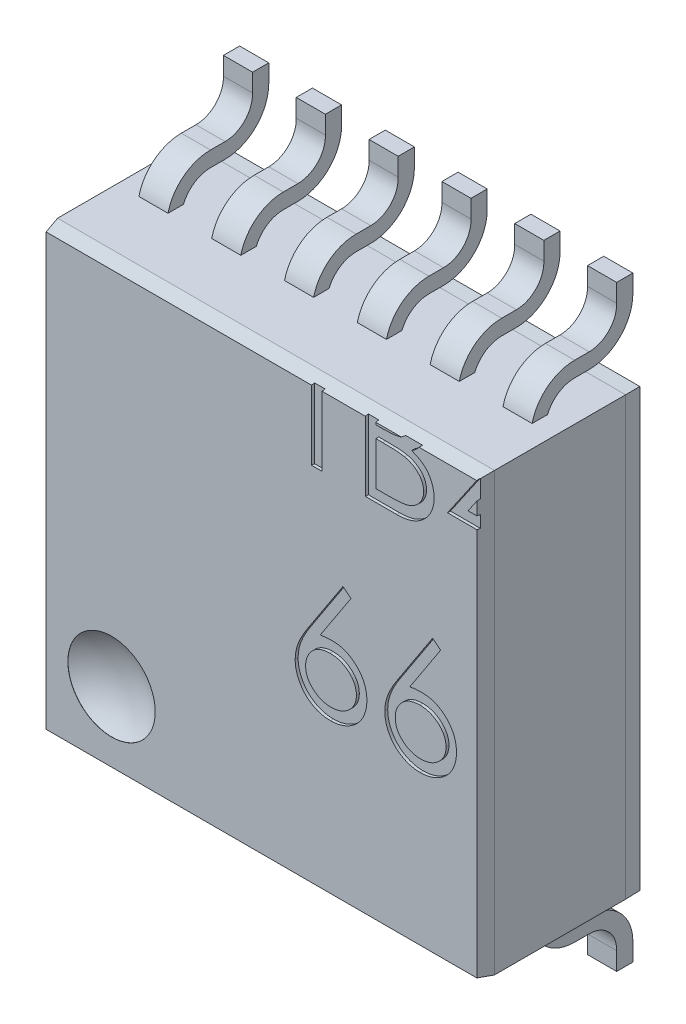
from build123d import *
from OCP.BRepFilletAPI import BRepFilletAPI_MakeChamfer

# Parameters (mm, degrees)
SKETCH1_W          = 3
SKETCH1_H          = 3
EXTRUDE2_DEPTH     = 1.1
CHAMFER2_SIZE      = 0.1
CHAMFER2_SIZE2     = 0.021255656
CHAMFER3_SIZE      = 0.1
CHAMFER3_SIZE2     = 0.001745506
SKETCH2_W          = 0.2
SKETCH2_H          = 0.548769717
EXTRUDE3_DEPTH     = 0.7
EXTRUDE3_2_DEPTH   = 0.7
EXTRUDE3_3_DEPTH   = 0.7
EXTRUDE3_4_DEPTH   = 0.7
EXTRUDE3_5_DEPTH   = 0.7
EXTRUDE3_6_DEPTH   = 0.7
EXTRUDE4_DEPTH     = 5.17080471
MIRROR1_START      = -3.15
MIRROR1_DEPTH      = 0.2
MIRROR1_START_2    = -2.65
MIRROR1_2_DEPTH    = 0.2
MIRROR1_START_3    = -2.15
MIRROR1_3_DEPTH    = 0.2
MIRROR1_START_4    = -1.65
MIRROR1_4_DEPTH    = 0.2
MIRROR1_START_5    = -1.15
MIRROR1_5_DEPTH    = 0.2
MIRROR1_START_6    = -0.65
MIRROR1_6_DEPTH    = 0.2
SKETCH4_R          = 0.3
EXTRUDE5_DEPTH     = 0.001
DOME1_FACE_RADIUS  = 0.3
DOME1_HEIGHT       = 0.1
CUT_EXTRUDE1_DEPTH = 0.02


with BuildPart() as part:
    # Sketch1 → Extrude2 (new body)
    with BuildSketch(Plane.XY.offset(0.1)):
        with Locations((-1.8, -0.75)):
            Rectangle(SKETCH1_W, SKETCH1_H)
    extrude(amount=EXTRUDE2_DEPTH)

    # Chamfer2: one chamfer whose edges measure the first distance from different faces: ONE call of the kernel's chamfer builder (chamfer() names one face for all edges)
    chamfer2_edges_1 = [part.edges().sort_by_distance(p)[0] for p in [
        (-0.3, -0.75, 1.2),
    ]]
    chamfer2_side_1 = [part.faces().sort_by_distance(p)[0] for p in [
        (-0.3, -0.75, 0.65),
    ]]
    chamfer2_edges_2 = [part.edges().sort_by_distance(p)[0] for p in [
        (-1.8, 0.75, 1.2),
    ]]
    chamfer2_side_2 = [part.faces().sort_by_distance(p)[0] for p in [
        (-1.8, 0.75, 0.65),
    ]]
    chamfer2_edges_3 = [part.edges().sort_by_distance(p)[0] for p in [
        (-3.3, -0.75, 1.2),
    ]]
    chamfer2_side_3 = [part.faces().sort_by_distance(p)[0] for p in [
        (-3.3, -0.75, 0.65),
    ]]
    chamfer2_edges_4 = [part.edges().sort_by_distance(p)[0] for p in [
        (-1.8, -2.25, 1.2),
    ]]
    chamfer2_side_4 = [part.faces().sort_by_distance(p)[0] for p in [
        (-1.8, -2.25, 0.65),
    ]]
    chamfer2 = BRepFilletAPI_MakeChamfer(part.part.solid().wrapped)
    for e in chamfer2_edges_1:
        chamfer2.Add(CHAMFER2_SIZE, CHAMFER2_SIZE2, e.wrapped, chamfer2_side_1[0].wrapped)  # the first distance lies on this face
    for e in chamfer2_edges_2:
        chamfer2.Add(CHAMFER2_SIZE, CHAMFER2_SIZE2, e.wrapped, chamfer2_side_2[0].wrapped)  # the first distance lies on this face
    for e in chamfer2_edges_3:
        chamfer2.Add(CHAMFER2_SIZE, CHAMFER2_SIZE2, e.wrapped, chamfer2_side_3[0].wrapped)  # the first distance lies on this face
    for e in chamfer2_edges_4:
        chamfer2.Add(CHAMFER2_SIZE, CHAMFER2_SIZE2, e.wrapped, chamfer2_side_4[0].wrapped)  # the first distance lies on this face
    add(Compound.cast(chamfer2.Shape()), mode=Mode.REPLACE)

    # Chamfer3: one chamfer whose edges measure the first distance from different faces: ONE call of the kernel's chamfer builder (chamfer() names one face for all edges)
    chamfer3_edges_1 = [part.edges().sort_by_distance(p)[0] for p in [
        (-1.8, 0.75, 0.1),
    ]]
    chamfer3_side_1 = [part.faces().sort_by_distance(p)[0] for p in [
        (-1.8, 0.75, 0.6),
    ]]
    chamfer3_edges_2 = [part.edges().sort_by_distance(p)[0] for p in [
        (-0.3, -0.75, 0.1),
    ]]
    chamfer3_side_2 = [part.faces().sort_by_distance(p)[0] for p in [
        (-0.3, -0.75, 0.6),
    ]]
    chamfer3_edges_3 = [part.edges().sort_by_distance(p)[0] for p in [
        (-1.8, -2.25, 0.1),
    ]]
    chamfer3_side_3 = [part.faces().sort_by_distance(p)[0] for p in [
        (-1.8, -2.25, 0.6),
    ]]
    chamfer3_edges_4 = [part.edges().sort_by_distance(p)[0] for p in [
        (-3.3, -0.75, 0.1),
    ]]
    chamfer3_side_4 = [part.faces().sort_by_distance(p)[0] for p in [
        (-3.3, -0.75, 0.6),
    ]]
    chamfer3 = BRepFilletAPI_MakeChamfer(part.part.solid().wrapped)
    for e in chamfer3_edges_1:
        chamfer3.Add(CHAMFER3_SIZE, CHAMFER3_SIZE2, e.wrapped, chamfer3_side_1[0].wrapped)  # the first distance lies on this face
    for e in chamfer3_edges_2:
        chamfer3.Add(CHAMFER3_SIZE, CHAMFER3_SIZE2, e.wrapped, chamfer3_side_2[0].wrapped)  # the first distance lies on this face
    for e in chamfer3_edges_3:
        chamfer3.Add(CHAMFER3_SIZE, CHAMFER3_SIZE2, e.wrapped, chamfer3_side_3[0].wrapped)  # the first distance lies on this face
    for e in chamfer3_edges_4:
        chamfer3.Add(CHAMFER3_SIZE, CHAMFER3_SIZE2, e.wrapped, chamfer3_side_4[0].wrapped)  # the first distance lies on this face
    add(Compound.cast(chamfer3.Shape()), mode=Mode.REPLACE)

    # Mirror1: read off the stored shape, not the designer's step
    # Mirror1 outline → Mirror1 (add)
    with BuildSketch(Plane.YZ.offset(MIRROR1_START)):
        with BuildLine():
            Line((1.298769717, 0), (1.298769717, 0.111270078))
            Line((1.298769717, 0.111270078), (1.175, 0.111270078))
            ThreePointArc((1.175, 0.111270078), (1.037816324, 0.164485937), (0.980481976, 0.3))
            Line((0.980481976, 0.3), (0.980481976, 0.400050091))
            ThreePointArc((0.980481976, 0.400050091), (0.915912865, 0.585986361), (0.75, 0.691884367))
            Line((0.75, 0.691884367), (0.75, 0.585404962))
            ThreePointArc((0.75, 0.585404962), (0.84083124, 0.511803399), (0.875, 0.4))
            Line((0.875, 0.4), (0.875, 0.3))
            ThreePointArc((0.875, 0.3), (0.962867966, 0.087867966), (1.175, 0))
            Line((1.175, 0), (1.298769717, 0))
        make_face()
    extrude(amount=MIRROR1_DEPTH)

    # Mirror1 2 outline → Mirror1 2 (add)
    with BuildSketch(Plane.YZ.offset(MIRROR1_START_2)):
        with BuildLine():
            Line((1.298769717, 0), (1.298769717, 0.111270078))
            Line((1.298769717, 0.111270078), (1.175, 0.111270078))
            ThreePointArc((1.175, 0.111270078), (1.037816324, 0.164485937), (0.980481976, 0.3))
            Line((0.980481976, 0.3), (0.980481976, 0.400050091))
            ThreePointArc((0.980481976, 0.400050091), (0.915912865, 0.585986361), (0.75, 0.691884367))
            Line((0.75, 0.691884367), (0.75, 0.585404962))
            ThreePointArc((0.75, 0.585404962), (0.84083124, 0.511803399), (0.875, 0.4))
            Line((0.875, 0.4), (0.875, 0.3))
            ThreePointArc((0.875, 0.3), (0.962867966, 0.087867966), (1.175, 0))
            Line((1.175, 0), (1.298769717, 0))
        make_face()
    extrude(amount=MIRROR1_2_DEPTH)

    # Mirror1 3 outline → Mirror1 3 (add)
    with BuildSketch(Plane.YZ.offset(MIRROR1_START_3)):
        with BuildLine():
            Line((1.298769717, 0), (1.298769717, 0.111270078))
            Line((1.298769717, 0.111270078), (1.175, 0.111270078))
            ThreePointArc((1.175, 0.111270078), (1.037816324, 0.164485937), (0.980481976, 0.3))
            Line((0.980481976, 0.3), (0.980481976, 0.400050091))
            ThreePointArc((0.980481976, 0.400050091), (0.915912865, 0.585986361), (0.75, 0.691884367))
            Line((0.75, 0.691884367), (0.75, 0.585404962))
            ThreePointArc((0.75, 0.585404962), (0.84083124, 0.511803399), (0.875, 0.4))
            Line((0.875, 0.4), (0.875, 0.3))
            ThreePointArc((0.875, 0.3), (0.962867966, 0.087867966), (1.175, 0))
            Line((1.175, 0), (1.298769717, 0))
        make_face()
    extrude(amount=MIRROR1_3_DEPTH)

    # Mirror1 4 outline → Mirror1 4 (add)
    with BuildSketch(Plane.YZ.offset(MIRROR1_START_4)):
        with BuildLine():
            Line((1.298769717, 0), (1.298769717, 0.111270078))
            Line((1.298769717, 0.111270078), (1.175, 0.111270078))
            ThreePointArc((1.175, 0.111270078), (1.037816324, 0.164485937), (0.980481976, 0.3))
            Line((0.980481976, 0.3), (0.980481976, 0.400050091))
            ThreePointArc((0.980481976, 0.400050091), (0.915912865, 0.585986361), (0.75, 0.691884367))
            Line((0.75, 0.691884367), (0.75, 0.585404962))
            ThreePointArc((0.75, 0.585404962), (0.84083124, 0.511803399), (0.875, 0.4))
            Line((0.875, 0.4), (0.875, 0.3))
            ThreePointArc((0.875, 0.3), (0.962867966, 0.087867966), (1.175, 0))
            Line((1.175, 0), (1.298769717, 0))
        make_face()
    extrude(amount=MIRROR1_4_DEPTH)

    # Mirror1 5 outline → Mirror1 5 (add)
    with BuildSketch(Plane.YZ.offset(MIRROR1_START_5)):
        with BuildLine():
            Line((1.298769717, 0), (1.298769717, 0.111270078))
            Line((1.298769717, 0.111270078), (1.175, 0.111270078))
            ThreePointArc((1.175, 0.111270078), (1.037816324, 0.164485937), (0.980481976, 0.3))
            Line((0.980481976, 0.3), (0.980481976, 0.400050091))
            ThreePointArc((0.980481976, 0.400050091), (0.915912865, 0.585986361), (0.75, 0.691884367))
            Line((0.75, 0.691884367), (0.75, 0.585404962))
            ThreePointArc((0.75, 0.585404962), (0.84083124, 0.511803399), (0.875, 0.4))
            Line((0.875, 0.4), (0.875, 0.3))
            ThreePointArc((0.875, 0.3), (0.962867966, 0.087867966), (1.175, 0))
            Line((1.175, 0), (1.298769717, 0))
        make_face()
    extrude(amount=MIRROR1_5_DEPTH)

    # Mirror1 6 outline → Mirror1 6 (add)
    with BuildSketch(Plane.YZ.offset(MIRROR1_START_6)):
        with BuildLine():
            Line((1.298769717, 0), (1.298769717, 0.111270078))
            Line((1.298769717, 0.111270078), (1.175, 0.111270078))
            ThreePointArc((1.175, 0.111270078), (1.037816324, 0.164485937), (0.980481976, 0.3))
            Line((0.980481976, 0.3), (0.980481976, 0.400050091))
            ThreePointArc((0.980481976, 0.400050091), (0.915912865, 0.585986361), (0.75, 0.691884367))
            Line((0.75, 0.691884367), (0.75, 0.585404962))
            ThreePointArc((0.75, 0.585404962), (0.84083124, 0.511803399), (0.875, 0.4))
            Line((0.875, 0.4), (0.875, 0.3))
            ThreePointArc((0.875, 0.3), (0.962867966, 0.087867966), (1.175, 0))
            Line((1.175, 0), (1.298769717, 0))
        make_face()
    extrude(amount=MIRROR1_6_DEPTH)

    # Sketch4 → Extrude5 (cut)
    with BuildSketch(Plane.XY.offset(1.2)):
        with Locations((-2.829613335, -1.750129606)):
            Circle(SKETCH4_R)
    extrude(amount=-EXTRUDE5_DEPTH, mode=Mode.SUBTRACT)

    # Dome1: a dome of height H over a round flat face of radius A is a cap of a sphere of radius (A * A + H * H) / (2 * H)
    dome1_r = (DOME1_FACE_RADIUS * DOME1_FACE_RADIUS + DOME1_HEIGHT * DOME1_HEIGHT) / (2 * DOME1_HEIGHT)
    dome1_base = Plane((-2.829613335, -1.750129606, 1.199), z_dir=(0, 0, -1))
    with Locations(dome1_base.offset(DOME1_HEIGHT - dome1_r)):
        dome1_ball = Sphere(dome1_r, mode=Mode.PRIVATE)
    add(split(dome1_ball, bisect_by=dome1_base, keep=Keep.TOP, mode=Mode.PRIVATE), mode=Mode.SUBTRACT)

    # Sketch5 → Cut-Extrude1 (cut)
    # profile 1 of 14: a face of its own
    with BuildSketch(Plane.XY.offset(1.2)):
        Polygon((-1.630273204, 0.970399683), (-1.630273204, 1.052450965), (-1.209760384, 1.052450965), (-1.209760384, 0.970399683), (-1.384119358, 0.970399683), (-1.384119358, 0.252450965), (-1.45591423, 0.252450965), (-1.45591423, 0.970399683), align=None)
    # profile 2 of 14: a face of its own
    with BuildSketch(Plane.XY.offset(1.2)):
        with BuildLine():
            Line((-1.086683461, 1.052450965), (-0.930593717, 1.052450965))
            add(Edge.make_bspline(
                [(-0.930593717, 1.052450965), (-0.922952922, 1.052410794), (-0.90814316, 1.052332931), (-0.886607287, 1.051125358), (-0.866436131, 1.049478805), (-0.84762384, 1.046866213), (-0.830179108, 1.043713807), (-0.814049362, 1.039896249), (-0.799285894, 1.035318737), (-0.781660126, 1.028039587), (-0.761563975, 1.017222863), (-0.739804342, 1.001239191), (-0.721197659, 0.981688913), (-0.705155072, 0.959635735), (-0.692400531, 0.93537613), (-0.683173263, 0.909488315), (-0.677331463, 0.882306203), (-0.676730678, 0.863644905), (-0.676427051, 0.854213786)],
                knots=[0, 0, 0, 0, 1.001505555, 1.941167018, 2.826882275, 3.653841531, 4.429895133, 5.150066043, 5.825578002, 6.45369114, 7.647487171, 8.808567382, 9.977351308, 11.170798116, 12.373658725, 13.556498008, 14.765093433, 16, 16, 16, 16], degree=3))
            add(Edge.make_bspline(
                [(-0.676427051, 0.854213786), (-0.676676929, 0.845378916), (-0.677167964, 0.828017563), (-0.681863452, 0.802624624), (-0.689214462, 0.778452917), (-0.699432804, 0.755590657), (-0.712713261, 0.734554403), (-0.728452305, 0.715174457), (-0.747441288, 0.698271358), (-0.761668315, 0.688821551), (-0.768894999, 0.684021478)],
                knots=[0, 0, 0, 0, 1.044552857, 2.05264487, 3.044412934, 4.028983338, 5.005914585, 5.980388656, 6.974128949, 8, 8, 8, 8], degree=3))
            add(Edge.make_bspline(
                [(-0.768894999, 0.684021478), (-0.759806902, 0.680532335), (-0.742419119, 0.673856741), (-0.718490888, 0.66205435), (-0.697874923, 0.649217296), (-0.680412719, 0.635198587), (-0.665478397, 0.620088002), (-0.652437725, 0.603663976), (-0.641310554, 0.58571226), (-0.631776171, 0.566420023), (-0.624336456, 0.545984259), (-0.61876482, 0.524596653), (-0.615572261, 0.502333897), (-0.615117943, 0.487182953), (-0.614888589, 0.479534299)],
                knots=[0, 0, 0, 0, 1.27268992, 2.434971085, 3.483601985, 4.442670788, 5.356604649, 6.2567628, 7.179492994, 8.113709626, 9.066344395, 10.018646069, 10.999752585, 12, 12, 12, 12], degree=3))
            add(Edge.make_bspline(
                [(-0.614888589, 0.479534299), (-0.615111868, 0.471724728), (-0.615551176, 0.456359179), (-0.618792312, 0.433786576), (-0.624280108, 0.41221516), (-0.631839227, 0.391505404), (-0.641704899, 0.371697373), (-0.653711291, 0.352768627), (-0.668027077, 0.334909352), (-0.684041447, 0.317921095), (-0.702158509, 0.302646172), (-0.721704967, 0.289042582), (-0.742926983, 0.277854911), (-0.765476011, 0.268456963), (-0.789604997, 0.261278175), (-0.815205593, 0.256255872), (-0.842255719, 0.252871864), (-0.860817948, 0.252593645), (-0.870337307, 0.252450965)],
                knots=[0, 0, 0, 0, 0.978564426, 1.925352924, 2.850884081, 3.763762016, 4.682927383, 5.618979971, 6.567305752, 7.547517671, 8.540179244, 9.531824382, 10.526200242, 11.540722885, 12.589160233, 13.674978461, 14.80764778, 16, 16, 16, 16], degree=3))
            Line((-0.870337307, 0.252450965), (-1.086683461, 0.252450965))
            Line((-1.086683461, 0.252450965), (-1.086683461, 1.052450965))
        make_face()
        with BuildLine():
            Line((-1.014888589, 0.970399683), (-1.014888589, 0.713989427))
            Line((-1.014888589, 0.713989427), (-0.96665141, 0.713989427))
            add(Edge.make_bspline(
                [(-0.96665141, 0.713989427), (-0.959600256, 0.714080838), (-0.945975991, 0.714257462), (-0.926245729, 0.714763409), (-0.907931439, 0.716180105), (-0.891064735, 0.717596393), (-0.875672176, 0.719899156), (-0.861787865, 0.722640213), (-0.8491939, 0.725539163), (-0.834670575, 0.730469331), (-0.818196758, 0.737755657), (-0.800634906, 0.749063505), (-0.785152742, 0.762531929), (-0.772079099, 0.77807272), (-0.761379334, 0.795184991), (-0.753947628, 0.813595706), (-0.748908248, 0.832846022), (-0.748453041, 0.846061623), (-0.748221922, 0.852771478)],
                knots=[0, 0, 0, 0, 1.156816544, 2.235205308, 3.236616184, 4.169592532, 5.011045266, 5.787822928, 6.49130361, 7.128639758, 8.301311294, 9.436451833, 10.541879658, 11.654887649, 12.756523258, 13.837046038, 14.901820046, 16, 16, 16, 16], degree=3))
            add(Edge.make_bspline(
                [(-0.748221922, 0.852771478), (-0.748342192, 0.857211654), (-0.748578114, 0.865921545), (-0.750510298, 0.87861854), (-0.753794315, 0.89055997), (-0.758012439, 0.90190948), (-0.763906996, 0.912312189), (-0.770847217, 0.922127777), (-0.779232517, 0.931021975), (-0.788777046, 0.939335003), (-0.799750445, 0.946705181), (-0.812146169, 0.953160213), (-0.826131924, 0.958358105), (-0.841472005, 0.962910368), (-0.858402539, 0.966107692), (-0.876728152, 0.968771324), (-0.896598945, 0.970127379), (-0.910346397, 0.970306891), (-0.917452692, 0.970399683)],
                knots=[0, 0, 0, 0, 0.91205012, 1.789085906, 2.630437955, 3.453916878, 4.269457761, 5.079663411, 5.91843418, 6.774407191, 7.675494373, 8.627863946, 9.638891023, 10.736472738, 11.911756761, 13.175263542, 14.539845004, 16, 16, 16, 16], degree=3))
            Line((-0.917452692, 0.970399683), (-1.014888589, 0.970399683))
        make_face(mode=Mode.SUBTRACT)
        with BuildLine():
            Line((-1.014888589, 0.631938145), (-1.014888589, 0.334502247))
            Line((-1.014888589, 0.334502247), (-0.912644999, 0.334502247))
            add(Edge.make_bspline(
                [(-0.912644999, 0.334502247), (-0.905326388, 0.334589961), (-0.891220729, 0.334759018), (-0.870854733, 0.335310916), (-0.851978595, 0.336566293), (-0.83467845, 0.338542487), (-0.818767489, 0.340686133), (-0.804436586, 0.343568711), (-0.79156957, 0.346871331), (-0.776649728, 0.351976284), (-0.759848926, 0.359906906), (-0.741743588, 0.371864444), (-0.725646166, 0.386109771), (-0.711976393, 0.402596837), (-0.700773424, 0.420523998), (-0.692623606, 0.439528649), (-0.687597124, 0.45929677), (-0.686988628, 0.472774876), (-0.686683461, 0.479534299)],
                knots=[0, 0, 0, 0, 1.160039823, 2.235823828, 3.228722157, 4.157150951, 4.99529583, 5.772374946, 6.472645482, 7.099169577, 8.269452708, 9.405989375, 10.527446681, 11.663510218, 12.788923519, 13.866172445, 14.929861265, 16, 16, 16, 16], degree=3))
            add(Edge.make_bspline(
                [(-0.686683461, 0.479534299), (-0.68674657, 0.483761348), (-0.686871772, 0.492147264), (-0.688759912, 0.504470879), (-0.69150594, 0.516408222), (-0.695055982, 0.527991705), (-0.700226145, 0.539011906), (-0.706261927, 0.549686777), (-0.713338819, 0.560030429), (-0.724366057, 0.573107515), (-0.740405368, 0.588174261), (-0.763195488, 0.60292569), (-0.789109156, 0.614822332), (-0.807904011, 0.619873641), (-0.817612948, 0.622483017)],
                knots=[0, 0, 0, 0, 0.723448775, 1.435228256, 2.130040452, 2.821711965, 3.505591119, 4.210454504, 4.921174351, 5.648778258, 7.137944449, 8.670945889, 10.280296675, 12, 12, 12, 12], degree=3))
            add(Edge.make_bspline(
                [(-0.817612948, 0.622483017), (-0.821505313, 0.62327275), (-0.829944762, 0.624985055), (-0.843706495, 0.62679253), (-0.859417551, 0.62840283), (-0.877114209, 0.629593951), (-0.896818858, 0.630825161), (-0.918573582, 0.631303977), (-0.94228954, 0.631875237), (-0.958744939, 0.631916639), (-0.967292435, 0.631938145)],
                knots=[0, 0, 0, 0, 0.634451884, 1.375622551, 2.216452059, 3.157844607, 4.20941857, 5.370758133, 6.634282058, 8, 8, 8, 8], degree=3))
            Line((-0.967292435, 0.631938145), (-1.014888589, 0.631938145))
        make_face(mode=Mode.SUBTRACT)
    # profile 3 of 14: a face of its own
    with BuildSketch(Plane.XY.offset(1.2)):
        Polygon((-0.085882179, 1.072963786), (-0.071298845, 1.072963786), (-0.071298845, 0.519117632), (0.021008847, 0.519117632), (0.021008847, 0.43706635), (-0.071298845, 0.43706635), (-0.071298845, 0.252450965), (-0.143093717, 0.252450965), (-0.143093717, 0.43706635), (-0.522580897, 0.43706635), align=None)
        Polygon((-0.143093717, 0.519117632), (-0.143093717, 0.866553529), (-0.381555256, 0.519117632), align=None, mode=Mode.SUBTRACT)
    # profile 4 of 14: a face of its own
    with BuildSketch(Plane.XY.offset(1.2)):
        Polygon((0.529502437, 1.072963786), (0.54408577, 1.072963786), (0.54408577, 0.519117632), (0.636393462, 0.519117632), (0.636393462, 0.43706635), (0.54408577, 0.43706635), (0.54408577, 0.252450965), (0.472290898, 0.252450965), (0.472290898, 0.43706635), (0.092803719, 0.43706635), align=None)
        Polygon((0.472290898, 0.519117632), (0.472290898, 0.866553529), (0.23382936, 0.519117632), align=None, mode=Mode.SUBTRACT)
    # profile 5 of 14: a face of its own
    with BuildSketch(Plane.XY.offset(1.2)):
        with BuildLine():
            Line((1.210752437, 1.052450965), (1.210752437, 0.970399683))
            Line((1.210752437, 0.970399683), (0.938637052, 0.970399683))
            Line((0.938637052, 0.970399683), (0.895528078, 0.759983017))
            add(Edge.make_bspline(
                [(0.895528078, 0.759983017), (0.903997992, 0.762321364), (0.920407111, 0.766851543), (0.944626508, 0.771881434), (0.967619011, 0.774913535), (0.982539096, 0.775327549), (0.989758847, 0.775527888)],
                knots=[0, 0, 0, 0, 1.100273476, 2.13160584, 3.095893838, 4, 4, 4, 4], degree=3))
            add(Edge.make_bspline(
                [(0.989758847, 0.775527888), (0.998692273, 0.775334532), (1.016257621, 0.774954344), (1.041957952, 0.771303635), (1.066491184, 0.765557369), (1.089806012, 0.757529821), (1.111945566, 0.74726474), (1.132706152, 0.734441896), (1.152399389, 0.719462849), (1.170671982, 0.702241132), (1.187248967, 0.68328762), (1.20182405, 0.662908678), (1.214204071, 0.641302355), (1.224160815, 0.618262216), (1.23211152, 0.594042981), (1.237403404, 0.568389819), (1.240927223, 0.541544534), (1.241320912, 0.523189204), (1.241521667, 0.51382917)],
                knots=[0, 0, 0, 0, 1.052922333, 2.070308379, 3.05430497, 4.020497103, 4.973039431, 5.925935799, 6.892292201, 7.88610001, 8.88166317, 9.857072816, 10.836096531, 11.812156883, 12.81219415, 13.836441305, 14.89672472, 16, 16, 16, 16], degree=3))
            add(Edge.make_bspline(
                [(1.241521667, 0.51382917), (1.24136965, 0.507309806), (1.24106767, 0.49435918), (1.239531993, 0.47512622), (1.236575258, 0.456300429), (1.232605492, 0.437879311), (1.22745294, 0.41989774), (1.221215442, 0.402304248), (1.213582064, 0.385208338), (1.205209178, 0.368448248), (1.195781412, 0.352402875), (1.185317753, 0.337397392), (1.174262783, 0.323206699), (1.16236761, 0.309982989), (1.149521668, 0.297813156), (1.135880533, 0.286624978), (1.121553054, 0.276229245), (1.10631757, 0.267047943), (1.090513574, 0.258599268), (1.073912839, 0.251668173), (1.05689325, 0.245471481), (1.03920985, 0.240532161), (1.020902693, 0.236661862), (1.001941601, 0.234033154), (0.982426019, 0.232118539), (0.969197445, 0.231998686), (0.962515257, 0.231938145)],
                knots=[0, 0, 0, 0, 1.056347294, 2.098418968, 3.122841568, 4.141288669, 5.149314143, 6.15115421, 7.162517403, 8.180376062, 9.185164535, 10.17417709, 11.141909838, 12.097768115, 13.052685741, 14.0056014, 14.954263652, 15.917497458, 16.885230207, 17.854509472, 18.828990115, 19.81800267, 20.826176721, 21.857883937, 22.917946725, 24, 24, 24, 24], degree=3))
            add(Edge.make_bspline(
                [(0.962515257, 0.231938145), (0.954544016, 0.232096051), (0.93886154, 0.232406712), (0.915885411, 0.235656651), (0.893779215, 0.240311261), (0.872720906, 0.247313837), (0.85252176, 0.256088075), (0.83345371, 0.267177486), (0.815029533, 0.279744138), (0.79799821, 0.294573933), (0.782191099, 0.310783232), (0.76804104, 0.32837355), (0.755439079, 0.347054565), (0.744587023, 0.366917), (0.735330332, 0.387908665), (0.728058335, 0.410108208), (0.722188996, 0.433399637), (0.719705929, 0.449434725), (0.718444744, 0.45757917)],
                knots=[0, 0, 0, 0, 1.0467383, 2.05933395, 3.04377827, 4.011590433, 4.970194871, 5.932262533, 6.905835911, 7.896367577, 8.894135286, 9.877477877, 10.858688626, 11.851381753, 12.8477658, 13.868841284, 14.917554742, 16, 16, 16, 16], degree=3))
            Line((0.718444744, 0.45757917), (0.790239616, 0.45757917))
            add(Edge.make_bspline(
                [(0.790239616, 0.45757917), (0.792006143, 0.449950267), (0.795401507, 0.435287091), (0.80285425, 0.414685642), (0.81196645, 0.396326962), (0.82280173, 0.3799682), (0.835727451, 0.365703286), (0.850477035, 0.352990815), (0.867013657, 0.341522214), (0.885389252, 0.331962724), (0.904775099, 0.323809866), (0.925064747, 0.318380908), (0.945705741, 0.314563561), (0.959666511, 0.314181444), (0.966681924, 0.313989427)],
                knots=[0, 0, 0, 0, 1.136247022, 2.183929868, 3.172523383, 4.106158343, 5.02341133, 5.958108904, 6.928429099, 7.938127109, 8.96079061, 9.975095812, 10.982467395, 12, 12, 12, 12], degree=3))
            add(Edge.make_bspline(
                [(0.966681924, 0.313989427), (0.973529568, 0.314177033), (0.987012636, 0.314546432), (1.006855239, 0.317389634), (1.026012467, 0.321768508), (1.044295292, 0.328321618), (1.062023644, 0.336286125), (1.078749077, 0.346506713), (1.094955449, 0.358269003), (1.110139022, 0.371744804), (1.124045182, 0.38659502), (1.136332295, 0.402475567), (1.146567018, 0.419416561), (1.155191958, 0.43712471), (1.161741283, 0.455794095), (1.166413507, 0.47533722), (1.169157064, 0.495802359), (1.169534476, 0.509761058), (1.169726796, 0.516874042)],
                knots=[0, 0, 0, 0, 1.027316725, 2.022795036, 3.002884548, 3.971462791, 4.93288096, 5.914575861, 6.907176829, 7.935150275, 8.956128384, 9.956726525, 10.942570165, 11.921478529, 12.907843606, 13.90538589, 14.932640048, 16, 16, 16, 16], degree=3))
            add(Edge.make_bspline(
                [(1.169726796, 0.516874042), (1.169576286, 0.523291357), (1.169281685, 0.535852337), (1.166874697, 0.554229299), (1.162687961, 0.571617423), (1.156876788, 0.588100676), (1.149498615, 0.603694606), (1.140482315, 0.618415305), (1.129658681, 0.632068753), (1.117294821, 0.644661337), (1.103750126, 0.656283022), (1.088791556, 0.666190242), (1.072732144, 0.674524852), (1.055765379, 0.681717537), (1.037487688, 0.686883422), (1.018261029, 0.690761796), (0.997877781, 0.693005307), (0.983941624, 0.693316596), (0.976778078, 0.693476606)],
                knots=[0, 0, 0, 0, 1.045622112, 2.046656509, 3.013763289, 3.955457236, 4.890082067, 5.820317437, 6.762574623, 7.722996705, 8.69280354, 9.665887285, 10.63943826, 11.638615906, 12.663482002, 13.728887084, 14.832589034, 16, 16, 16, 16], degree=3))
            add(Edge.make_bspline(
                [(0.976778078, 0.693476606), (0.97057718, 0.6933439), (0.957773898, 0.693069894), (0.938134395, 0.691052409), (0.917496287, 0.687797713), (0.895938688, 0.683320857), (0.873396858, 0.677462325), (0.849918366, 0.670441868), (0.825453848, 0.662048268), (0.808969797, 0.655709476), (0.800496026, 0.652450965)],
                knots=[0, 0, 0, 0, 0.817624296, 1.688186739, 2.600797293, 3.572016777, 4.590301741, 5.671205678, 6.80286297, 8, 8, 8, 8], degree=3))
            Line((0.800496026, 0.652450965), (0.882547308, 1.052450965))
            Line((0.882547308, 1.052450965), (1.210752437, 1.052450965))
        make_face()
    # profile 6 of 14: a face of its own
    with BuildSketch(Plane.XY.offset(1.2)):
        Polygon((1.723572949, 1.052450965), (2.092803719, 0.252450965), (2.014758847, 0.252450965), (1.896489616, 0.508861222), (1.53382936, 0.508861222), (1.412194744, 0.252450965), (1.33382936, 0.252450965), (1.713316539, 1.052450965), align=None)
        Polygon((1.717643462, 0.896521478), (1.572771667, 0.590912504), (1.858669103, 0.590912504), align=None, mode=Mode.SUBTRACT)
    # profile 7 of 14: a face of its own
    with BuildSketch(Plane.XY.offset(1.2)):
        Polygon((2.334630642, 1.052450965), (2.482547308, 1.052450965), (2.482547308, 0.252450965), (2.410752437, 0.252450965), (2.410752437, 0.970399683), (2.287675514, 0.970399683), align=None)
    # profile 8 of 14: a face of its own
    with BuildSketch(Plane.XY.offset(1.2)):
        with BuildLine():
            Line((-1.240529615, -0.360369548), (-1.185241153, -0.403799035))
            Line((-1.185241153, -0.403799035), (-1.396619358, -0.727036214))
            add(Edge.make_bspline(
                [(-1.396619358, -0.727036214), (-1.382546152, -0.724793046), (-1.355094772, -0.720417493), (-1.327308281, -0.719695677), (-1.313766794, -0.719343907)],
                knots=[0, 0, 0, 0, 1.025318673, 2, 2, 2, 2], degree=3))
            add(Edge.make_bspline(
                [(-1.313766794, -0.719343907), (-1.305635938, -0.719562446), (-1.289630589, -0.719992636), (-1.266131892, -0.72330323), (-1.243551563, -0.728520398), (-1.221983195, -0.736125485), (-1.20134937, -0.745840309), (-1.18153168, -0.75748348), (-1.162902649, -0.771656207), (-1.145222379, -0.787488196), (-1.129170471, -0.805023507), (-1.114958802, -0.823629527), (-1.103021249, -0.843286871), (-1.093335781, -0.863985583), (-1.085814666, -0.885693757), (-1.080331776, -0.908383618), (-1.077090726, -0.932070811), (-1.076650614, -0.948180108), (-1.076427051, -0.956363137)],
                knots=[0, 0, 0, 0, 1.04369286, 2.054478336, 3.041073146, 4.015093852, 4.984733326, 5.965804835, 6.960378782, 7.985147595, 9.009457201, 10.008161701, 10.986880575, 11.956520048, 12.937015923, 13.931873656, 14.949455224, 16, 16, 16, 16], degree=3))
            add(Edge.make_bspline(
                [(-1.076427051, -0.956363137), (-1.076752332, -0.967558498), (-1.077392408, -0.989588319), (-1.083770418, -1.021674423), (-1.093681194, -1.052241855), (-1.107847487, -1.08080258), (-1.12544346, -1.107317453), (-1.146901195, -1.130811274), (-1.171459707, -1.151764425), (-1.199228118, -1.169285938), (-1.229112224, -1.183595207), (-1.260506966, -1.193872977), (-1.293107457, -1.200200627), (-1.315234224, -1.200993908), (-1.326427051, -1.201395189)],
                knots=[0, 0, 0, 0, 1.031375318, 2.029502543, 3.004789286, 3.987476834, 4.960371455, 5.9300674, 6.912260825, 7.929083631, 8.949397511, 9.960523116, 10.96833055, 12, 12, 12, 12], degree=3))
            add(Edge.make_bspline(
                [(-1.326427051, -1.201395189), (-1.337192011, -1.201045884), (-1.358515512, -1.200353974), (-1.389883008, -1.194190331), (-1.420023126, -1.184200136), (-1.448724699, -1.170436873), (-1.475312268, -1.153052214), (-1.499098699, -1.132123693), (-1.51996539, -1.108098672), (-1.537331018, -1.080980878), (-1.551104442, -1.051840317), (-1.561433568, -1.021454681), (-1.567466995, -0.989934685), (-1.568310094, -0.968567568), (-1.568734743, -0.957805445)],
                knots=[0, 0, 0, 0, 1.012016664, 2.004627821, 2.994792927, 3.992885782, 4.990978636, 5.973936114, 6.964471063, 7.975201453, 8.993600317, 9.990122807, 10.98767138, 12, 12, 12, 12], degree=3))
            add(Edge.make_bspline(
                [(-1.568734743, -0.957805445), (-1.568464698, -0.949566683), (-1.567913319, -0.932744706), (-1.564063401, -0.907267213), (-1.557877162, -0.881198395), (-1.550949106, -0.859083151), (-1.543628967, -0.840966231), (-1.537536958, -0.826359719), (-1.52995433, -0.811328617), (-1.521868986, -0.7953575), (-1.51255313, -0.778857972), (-1.502423839, -0.761554276), (-1.491201061, -0.743721607), (-1.483333595, -0.731620077), (-1.479311666, -0.72543365)],
                knots=[0, 0, 0, 0, 1.173818275, 2.396712641, 3.66331629, 4.989737886, 5.693666774, 6.447286557, 7.243889047, 8.091586357, 8.998013824, 9.943181721, 10.948533338, 12, 12, 12, 12], degree=3))
            Line((-1.479311666, -0.72543365), (-1.240529615, -0.360369548))
        make_face()
        with BuildLine():
            add(Edge.make_bspline(
                [(-1.328830897, -0.801395189), (-1.334925124, -0.801573027), (-1.346828921, -0.801920398), (-1.364293473, -0.803937598), (-1.380822216, -0.807736242), (-1.396634132, -0.81257426), (-1.411433607, -0.819226388), (-1.425328199, -0.827306799), (-1.438371639, -0.836820212), (-1.450427308, -0.847631848), (-1.461357517, -0.859469113), (-1.470770347, -0.872147861), (-1.478889753, -0.885362536), (-1.485491311, -0.899223551), (-1.4906319, -0.913725608), (-1.494350357, -0.928802008), (-1.496419786, -0.94455385), (-1.496764068, -0.955235565), (-1.496939871, -0.96069006)],
                knots=[0, 0, 0, 0, 1.129588631, 2.206414736, 3.251139165, 4.268635594, 5.265702196, 6.250456724, 7.242448911, 8.251968645, 9.246821453, 10.222880186, 11.173611482, 12.116736599, 13.062300278, 14.020270554, 14.989073742, 16, 16, 16, 16], degree=3))
            add(Edge.make_bspline(
                [(-1.496939871, -0.96069006), (-1.496796703, -0.96609577), (-1.496515971, -0.976695562), (-1.493966869, -0.992315946), (-1.490073136, -1.007347925), (-1.484281046, -1.021714005), (-1.477372043, -1.035633163), (-1.468250826, -1.048601228), (-1.458144132, -1.061405816), (-1.446063233, -1.073063295), (-1.433097893, -1.083910523), (-1.419246189, -1.093391724), (-1.404809627, -1.10150285), (-1.389593302, -1.107859672), (-1.3738131, -1.113076652), (-1.357337545, -1.116747847), (-1.340155178, -1.118823396), (-1.328515878, -1.119168126), (-1.322580897, -1.119343907)],
                knots=[0, 0, 0, 0, 0.989467248, 1.94019797, 2.891935182, 3.827694429, 4.772920941, 5.730924762, 6.725747692, 7.756678648, 8.79901574, 9.819492441, 10.826891316, 11.826466727, 12.835195252, 13.867842842, 14.912794438, 16, 16, 16, 16], degree=3))
            add(Edge.make_bspline(
                [(-1.322580897, -1.119343907), (-1.316645926, -1.119168112), (-1.305006645, -1.118823355), (-1.287824139, -1.116748002), (-1.271349095, -1.113076083), (-1.255567036, -1.107861735), (-1.240357566, -1.101495196), (-1.22593363, -1.093442186), (-1.212212923, -1.083852216), (-1.199239071, -1.073081832), (-1.187208457, -1.061339466), (-1.176859365, -1.048715529), (-1.168017483, -1.035528353), (-1.160832526, -1.021768836), (-1.15510423, -1.007339238), (-1.151190752, -0.992318273), (-1.148646915, -0.976694953), (-1.14836546, -0.966095564), (-1.148221922, -0.96069006)],
                knots=[0, 0, 0, 0, 1.087397944, 2.132534446, 3.165364764, 4.174271784, 5.174024072, 6.181601208, 7.194203697, 8.236725232, 9.267838612, 10.269026844, 11.221737037, 12.171628256, 13.107553087, 14.05945871, 15.010357665, 16, 16, 16, 16], degree=3))
            add(Edge.make_bspline(
                [(-1.148221922, -0.96069006), (-1.148347704, -0.955228449), (-1.148594571, -0.944509081), (-1.151386788, -0.928809054), (-1.155259331, -0.913649007), (-1.161106881, -0.899124219), (-1.168703805, -0.885292007), (-1.177957155, -0.872082498), (-1.188661743, -0.859394419), (-1.201026895, -0.847608634), (-1.21448752, -0.836832159), (-1.228799653, -0.827319118), (-1.243772905, -0.819290551), (-1.259392091, -0.812591785), (-1.275836179, -0.80775762), (-1.292839685, -0.803951164), (-1.310620083, -0.80192556), (-1.322683308, -0.801574231), (-1.328830897, -0.801395189)],
                knots=[0, 0, 0, 0, 0.978206639, 1.919901502, 2.851605144, 3.780102724, 4.718870031, 5.675451981, 6.667674623, 7.690630536, 8.733308323, 9.756129687, 10.767539656, 11.776269907, 12.797430371, 13.836405707, 14.897401972, 16, 16, 16, 16], degree=3))
        make_face(mode=Mode.SUBTRACT)
    # profile 9 of 14: a face of its own
    with BuildSketch(Plane.XY.offset(1.2)):
        with BuildLine():
            Line((-0.625144999, -0.360369548), (-0.569856538, -0.403799035))
            Line((-0.569856538, -0.403799035), (-0.781234743, -0.727036214))
            add(Edge.make_bspline(
                [(-0.781234743, -0.727036214), (-0.767161537, -0.724793046), (-0.739710157, -0.720417493), (-0.711923666, -0.719695677), (-0.698382179, -0.719343907)],
                knots=[0, 0, 0, 0, 1.025318673, 2, 2, 2, 2], degree=3))
            add(Edge.make_bspline(
                [(-0.698382179, -0.719343907), (-0.690251322, -0.719562446), (-0.674245974, -0.719992636), (-0.650747276, -0.72330323), (-0.628166948, -0.728520398), (-0.606598579, -0.736125485), (-0.585964755, -0.745840309), (-0.566147064, -0.75748348), (-0.547518034, -0.771656207), (-0.529837764, -0.787488196), (-0.513785856, -0.805023507), (-0.499574186, -0.823629527), (-0.487636634, -0.843286871), (-0.477951166, -0.863985583), (-0.470430051, -0.885693757), (-0.464947161, -0.908383618), (-0.461706111, -0.932070811), (-0.461265999, -0.948180108), (-0.461042435, -0.956363137)],
                knots=[0, 0, 0, 0, 1.04369286, 2.054478336, 3.041073146, 4.015093852, 4.984733326, 5.965804835, 6.960378782, 7.985147595, 9.009457201, 10.008161701, 10.986880575, 11.956520048, 12.937015923, 13.931873656, 14.949455224, 16, 16, 16, 16], degree=3))
            add(Edge.make_bspline(
                [(-0.461042435, -0.956363137), (-0.461367716, -0.967558498), (-0.462007793, -0.989588319), (-0.468385803, -1.021674423), (-0.478296579, -1.052241855), (-0.492462871, -1.08080258), (-0.510058845, -1.107317453), (-0.53151658, -1.130811274), (-0.556075092, -1.151764425), (-0.583843503, -1.169285938), (-0.613727609, -1.183595207), (-0.645122351, -1.193872977), (-0.677722842, -1.200200627), (-0.699849609, -1.200993908), (-0.711042435, -1.201395189)],
                knots=[0, 0, 0, 0, 1.031375318, 2.029502543, 3.004789286, 3.987476834, 4.960371455, 5.9300674, 6.912260825, 7.929083631, 8.949397511, 9.960523116, 10.96833055, 12, 12, 12, 12], degree=3))
            add(Edge.make_bspline(
                [(-0.711042435, -1.201395189), (-0.721807395, -1.201045884), (-0.743130897, -1.200353974), (-0.774498392, -1.194190331), (-0.804638511, -1.184200136), (-0.833340083, -1.170436873), (-0.859927652, -1.153052214), (-0.883714083, -1.132123693), (-0.904580775, -1.108098672), (-0.921946402, -1.080980878), (-0.935719827, -1.051840317), (-0.946048952, -1.021454681), (-0.95208238, -0.989934685), (-0.952925478, -0.968567568), (-0.953350128, -0.957805445)],
                knots=[0, 0, 0, 0, 1.012016664, 2.004627821, 2.994792927, 3.992885782, 4.990978636, 5.973936114, 6.964471063, 7.975201453, 8.993600317, 9.990122807, 10.98767138, 12, 12, 12, 12], degree=3))
            add(Edge.make_bspline(
                [(-0.953350128, -0.957805445), (-0.953080083, -0.949566683), (-0.952528704, -0.932744706), (-0.948678786, -0.907267213), (-0.942492547, -0.881198395), (-0.935564491, -0.859083151), (-0.928244351, -0.840966231), (-0.922152342, -0.826359719), (-0.914569714, -0.811328617), (-0.90648437, -0.7953575), (-0.897168514, -0.778857972), (-0.887039223, -0.761554276), (-0.875816446, -0.743721607), (-0.86794898, -0.731620077), (-0.863927051, -0.72543365)],
                knots=[0, 0, 0, 0, 1.173818275, 2.396712641, 3.66331629, 4.989737886, 5.693666774, 6.447286557, 7.243889047, 8.091586357, 8.998013824, 9.943181721, 10.948533338, 12, 12, 12, 12], degree=3))
            Line((-0.863927051, -0.72543365), (-0.625144999, -0.360369548))
        make_face()
        with BuildLine():
            add(Edge.make_bspline(
                [(-0.713446281, -0.801395189), (-0.719540509, -0.801573027), (-0.731444305, -0.801920398), (-0.748908857, -0.803937598), (-0.7654376, -0.807736242), (-0.781249517, -0.81257426), (-0.796048992, -0.819226388), (-0.809943583, -0.827306799), (-0.822987024, -0.836820212), (-0.835042693, -0.847631848), (-0.845972902, -0.859469113), (-0.855385732, -0.872147861), (-0.863505137, -0.885362536), (-0.870106696, -0.899223551), (-0.875247285, -0.913725608), (-0.878965742, -0.928802008), (-0.881035171, -0.94455385), (-0.881379452, -0.955235565), (-0.881555256, -0.96069006)],
                knots=[0, 0, 0, 0, 1.129588631, 2.206414736, 3.251139165, 4.268635594, 5.265702196, 6.250456724, 7.242448911, 8.251968645, 9.246821453, 10.222880186, 11.173611482, 12.116736599, 13.062300278, 14.020270554, 14.989073742, 16, 16, 16, 16], degree=3))
            add(Edge.make_bspline(
                [(-0.881555256, -0.96069006), (-0.881412087, -0.96609577), (-0.881131356, -0.976695562), (-0.878582254, -0.992315946), (-0.874688521, -1.007347925), (-0.86889643, -1.021714005), (-0.861987427, -1.035633163), (-0.85286621, -1.048601228), (-0.842759516, -1.061405816), (-0.830678617, -1.073063295), (-0.817713277, -1.083910523), (-0.803861574, -1.093391724), (-0.789425012, -1.10150285), (-0.774208687, -1.107859672), (-0.758428484, -1.113076652), (-0.741952929, -1.116747847), (-0.724770562, -1.118823396), (-0.713131262, -1.119168126), (-0.707196281, -1.119343907)],
                knots=[0, 0, 0, 0, 0.989467248, 1.94019797, 2.891935182, 3.827694429, 4.772920941, 5.730924762, 6.725747692, 7.756678648, 8.79901574, 9.819492441, 10.826891316, 11.826466727, 12.835195252, 13.867842842, 14.912794438, 16, 16, 16, 16], degree=3))
            add(Edge.make_bspline(
                [(-0.707196281, -1.119343907), (-0.70126131, -1.119168112), (-0.689622029, -1.118823355), (-0.672439524, -1.116748002), (-0.65596448, -1.113076083), (-0.640182421, -1.107861735), (-0.624972951, -1.101495196), (-0.610549014, -1.093442186), (-0.596828307, -1.083852216), (-0.583854456, -1.073081832), (-0.571823841, -1.061339466), (-0.561474749, -1.048715529), (-0.552632867, -1.035528353), (-0.54544791, -1.021768836), (-0.539719615, -1.007339238), (-0.535806137, -0.992318273), (-0.533262299, -0.976694953), (-0.532980844, -0.966095564), (-0.532837307, -0.96069006)],
                knots=[0, 0, 0, 0, 1.087397944, 2.132534446, 3.165364764, 4.174271784, 5.174024072, 6.181601208, 7.194203697, 8.236725232, 9.267838612, 10.269026844, 11.221737037, 12.171628256, 13.107553087, 14.05945871, 15.010357665, 16, 16, 16, 16], degree=3))
            add(Edge.make_bspline(
                [(-0.532837307, -0.96069006), (-0.532963088, -0.955228449), (-0.533209956, -0.944509081), (-0.536002173, -0.928809054), (-0.539874715, -0.913649007), (-0.545722265, -0.899124219), (-0.55331919, -0.885292007), (-0.56257254, -0.872082498), (-0.573277127, -0.859394419), (-0.585642279, -0.847608634), (-0.599102904, -0.836832159), (-0.613415038, -0.827319118), (-0.628388289, -0.819290551), (-0.644007476, -0.812591785), (-0.660451563, -0.80775762), (-0.67745507, -0.803951164), (-0.695235468, -0.80192556), (-0.707298693, -0.801574231), (-0.713446281, -0.801395189)],
                knots=[0, 0, 0, 0, 0.978206639, 1.919901502, 2.851605144, 3.780102724, 4.718870031, 5.675451981, 6.667674623, 7.690630536, 8.733308323, 9.756129687, 10.767539656, 11.776269907, 12.797430371, 13.836405707, 14.897401972, 16, 16, 16, 16], degree=3))
        make_face(mode=Mode.SUBTRACT)
    # profile 10 of 14: a face of its own
    with BuildSketch(Plane.XY.offset(1.2)):
        Polygon((-0.208959102, -0.380882368), (-0.061042435, -0.380882368), (-0.061042435, -1.180882368), (-0.132837307, -1.180882368), (-0.132837307, -0.46293365), (-0.25591423, -0.46293365), align=None)
    # profile 11 of 14: a face of its own
    with BuildSketch(Plane.XY.offset(1.2)):
        with BuildLine():
            Line((0.338957565, -0.627036214), (0.267162693, -0.627036214))
            add(Edge.make_bspline(
                [(0.267162693, -0.627036214), (0.267630614, -0.61751144), (0.268549597, -0.598805037), (0.272853206, -0.571531001), (0.279011121, -0.545461333), (0.287717739, -0.520805352), (0.298530603, -0.497345053), (0.311497466, -0.475173621), (0.326856061, -0.454375635), (0.344274743, -0.4351439), (0.363193289, -0.417501026), (0.383606075, -0.402265542), (0.405056367, -0.389392932), (0.427479087, -0.378631505), (0.451127215, -0.370553826), (0.475786154, -0.364560308), (0.501564243, -0.360954286), (0.519127676, -0.360566678), (0.528060129, -0.360369548)],
                knots=[0, 0, 0, 0, 1.10065271, 2.161652631, 3.183658789, 4.190468796, 5.17591951, 6.163126047, 7.15150782, 8.156236427, 9.156009102, 10.134482811, 11.092018607, 12.041330605, 13.001268258, 13.972401359, 14.968799086, 16, 16, 16, 16], degree=3))
            add(Edge.make_bspline(
                [(0.528060129, -0.360369548), (0.53683226, -0.360574909), (0.554069185, -0.360978437), (0.579226216, -0.364443815), (0.603175312, -0.369871379), (0.625869659, -0.377486331), (0.647128188, -0.387722772), (0.667110598, -0.400019352), (0.686054784, -0.414241028), (0.703107763, -0.430984757), (0.718766752, -0.448859587), (0.732275839, -0.467942537), (0.743844562, -0.487652088), (0.75348746, -0.508138534), (0.760586006, -0.529594769), (0.765975311, -0.551708415), (0.769021577, -0.574708372), (0.769489103, -0.590275585), (0.769726796, -0.59819006)],
                knots=[0, 0, 0, 0, 1.111607364, 2.184268762, 3.212621178, 4.221274766, 5.211760367, 6.196651075, 7.1921475, 8.207485113, 9.220403448, 10.201281604, 11.166441695, 12.114753415, 13.065576456, 14.026450734, 14.996634279, 16, 16, 16, 16], degree=3))
            add(Edge.make_bspline(
                [(0.769726796, -0.59819006), (0.769339764, -0.609332423), (0.768572493, -0.631421614), (0.762009207, -0.663882154), (0.751758576, -0.695332079), (0.739416323, -0.720643462), (0.726965478, -0.741039689), (0.715745477, -0.757832536), (0.702610663, -0.775913786), (0.687369863, -0.795222892), (0.67033835, -0.815911099), (0.651361855, -0.837965909), (0.630305059, -0.861159456), (0.615525973, -0.877000737), (0.607867821, -0.885209291)],
                knots=[0, 0, 0, 0, 1.184426356, 2.348067706, 3.509069118, 4.696110526, 5.333549288, 6.050745305, 6.844228056, 7.710549037, 8.667450064, 9.695053472, 10.805634456, 12, 12, 12, 12], degree=3))
            Line((0.607867821, -0.885209291), (0.407707565, -1.098831086))
            Line((0.407707565, -1.098831086), (0.779983206, -1.098831086))
            Line((0.779983206, -1.098831086), (0.779983206, -1.180882368))
            Line((0.779983206, -1.180882368), (0.236393462, -1.180882368))
            Line((0.236393462, -1.180882368), (0.546649872, -0.849792625))
            add(Edge.make_bspline(
                [(0.546649872, -0.849792625), (0.554203675, -0.841907297), (0.568712984, -0.826761198), (0.589234716, -0.804648521), (0.607666485, -0.78413434), (0.624127603, -0.765257415), (0.638260976, -0.747741628), (0.6508032, -0.732154267), (0.660852478, -0.717810393), (0.671758854, -0.701183967), (0.68232205, -0.680884008), (0.69139916, -0.656076308), (0.696933983, -0.63053865), (0.697597945, -0.613281042), (0.697931924, -0.604600317)],
                knots=[0, 0, 0, 0, 1.329631726, 2.553950428, 3.673215718, 4.687767853, 5.603093632, 6.413772471, 7.123043292, 7.734684054, 8.834405432, 9.900288307, 10.943827018, 12, 12, 12, 12], degree=3))
            add(Edge.make_bspline(
                [(0.697931924, -0.604600317), (0.697786611, -0.599141711), (0.697500228, -0.588383849), (0.694972754, -0.572611104), (0.69115321, -0.557396289), (0.685680008, -0.542692605), (0.678455611, -0.528647884), (0.669661695, -0.515245032), (0.659515395, -0.502287554), (0.647777962, -0.490138229), (0.6348839, -0.479011096), (0.621262358, -0.469154162), (0.606850905, -0.460916651), (0.591710306, -0.454163852), (0.57588277, -0.448866622), (0.559337685, -0.445196089), (0.542120767, -0.442891521), (0.53036454, -0.442579711), (0.524374231, -0.44242083)],
                knots=[0, 0, 0, 0, 0.991446411, 1.95395049, 2.89581595, 3.838931463, 4.798493298, 5.75982156, 6.748411868, 7.785213223, 8.824556874, 9.840280684, 10.836137867, 11.835679398, 12.848801643, 13.863922112, 14.911575587, 16, 16, 16, 16], degree=3))
            add(Edge.make_bspline(
                [(0.524374231, -0.44242083), (0.518118041, -0.442584266), (0.505831916, -0.442905227), (0.48779328, -0.445150407), (0.470585102, -0.449023742), (0.454164096, -0.454321268), (0.438502476, -0.46105465), (0.423676409, -0.469441335), (0.409719177, -0.47944899), (0.396604543, -0.490795403), (0.384521348, -0.503427998), (0.37390492, -0.517510275), (0.364628573, -0.532785113), (0.356535034, -0.549211296), (0.349962305, -0.566937874), (0.344939871, -0.585901921), (0.340965734, -0.606021094), (0.339638073, -0.619914828), (0.338957565, -0.627036214)],
                knots=[0, 0, 0, 0, 1.031018746, 2.02475058, 2.990194455, 3.934040569, 4.864654155, 5.795059489, 6.735614925, 7.690564532, 8.649604399, 9.611025574, 10.590972636, 11.591080095, 12.624614302, 13.701020113, 14.821632451, 16, 16, 16, 16], degree=3))
        make_face()
    # profile 12 of 14: a face of its own
    with BuildSketch(Plane.XY.offset(1.2)):
        Polygon((0.923572949, -0.380882368), (1.313316539, -0.380882368), (1.313316539, -0.46293365), (0.995367821, -0.46293365), (0.995367821, -0.709087496), (1.313316539, -0.709087496), (1.313316539, -0.791138778), (0.995367821, -0.791138778), (0.995367821, -1.180882368), (0.923572949, -1.180882368), align=None)
    # profile 13 of 14: a face of its own
    with BuildSketch(Plane.XY.offset(1.2)):
        Polygon((1.456906283, -1.180882368), (1.456906283, -0.380882368), (1.471970385, -0.380882368), (2.000496026, -1.010529804), (2.000496026, -0.380882368), (2.072290898, -0.380882368), (2.072290898, -1.180882368), (2.055944744, -1.180882368), (1.528701155, -0.55267724), (1.528701155, -1.180882368), align=None)
    # profile 14 of 14: a face of its own
    with BuildSketch(Plane.XY.offset(1.2)):
        with BuildLine():
            Line((3.026137052, -0.51742083), (2.96459859, -0.575754163))
            add(Edge.make_bspline(
                [(2.96459859, -0.575754163), (2.953462845, -0.565278537), (2.931456891, -0.544577083), (2.895580264, -0.517717427), (2.858148576, -0.494708032), (2.819357149, -0.475986607), (2.780166622, -0.461048833), (2.741097187, -0.45041383), (2.702549599, -0.443631535), (2.676911377, -0.442820479), (2.664278078, -0.44242083)],
                knots=[0, 0, 0, 0, 1.08915593, 2.152340314, 3.188132944, 4.216796309, 5.218260357, 6.173443236, 7.099959455, 8, 8, 8, 8], degree=3))
            add(Edge.make_bspline(
                [(2.664278078, -0.44242083), (2.656526146, -0.442515368), (2.641042388, -0.4427042), (2.618043087, -0.445114306), (2.595284998, -0.448580561), (2.572811084, -0.453595847), (2.550577647, -0.459952204), (2.528662015, -0.467903167), (2.507023305, -0.477172937), (2.485865344, -0.487884359), (2.465353229, -0.499651181), (2.445980238, -0.512690848), (2.427622889, -0.526585428), (2.410626221, -0.541682795), (2.394892464, -0.557846193), (2.380047122, -0.574774949), (2.366612311, -0.59293157), (2.354477188, -0.611981999), (2.343651675, -0.631591642), (2.334095411, -0.651571754), (2.32607322, -0.671856064), (2.319725916, -0.692470024), (2.314489195, -0.713254159), (2.31080517, -0.734352381), (2.308728205, -0.75578728), (2.308368941, -0.770140939), (2.308188334, -0.777356727)],
                knots=[0, 0, 0, 0, 1.02818874, 2.053710826, 3.065248034, 4.081641283, 5.106893873, 6.131558223, 7.173050175, 8.228653731, 9.27666206, 10.308777013, 11.325269123, 12.329503258, 13.32196095, 14.316845687, 15.314881793, 16.315733098, 17.311955233, 18.285320748, 19.252783886, 20.203351036, 21.145449891, 22.095197417, 23.042428769, 24, 24, 24, 24], degree=3))
            add(Edge.make_bspline(
                [(2.308188334, -0.777356727), (2.30836107, -0.784732914), (2.308706069, -0.799465146), (2.310914142, -0.821452362), (2.315012026, -0.843113026), (2.320490359, -0.864518313), (2.327343117, -0.885704884), (2.335885441, -0.906580886), (2.346003292, -0.927145547), (2.357714504, -0.947213574), (2.370557065, -0.966761693), (2.384944055, -0.985175298), (2.400226474, -1.00269959), (2.41696108, -1.018945479), (2.434611261, -1.034347513), (2.453704352, -1.048481346), (2.473864915, -1.061619226), (2.495123706, -1.073595573), (2.517250056, -1.084294667), (2.539937314, -1.0938087), (2.563257958, -1.101643978), (2.58708943, -1.10802983), (2.61140332, -1.113264184), (2.636323047, -1.116631608), (2.66166538, -1.119075226), (2.678748496, -1.119253894), (2.687355001, -1.119343907)],
                knots=[0, 0, 0, 0, 0.93586088, 1.869166235, 2.799637598, 3.729985548, 4.670839027, 5.622275134, 6.589130586, 7.576015415, 8.568469353, 9.55398029, 10.53834874, 11.515998671, 12.510579167, 13.508179873, 14.527009472, 15.561807829, 16.601455013, 17.643573243, 18.680854198, 19.719860599, 20.772568776, 21.833555941, 22.908541556, 24, 24, 24, 24], degree=3))
            add(Edge.make_bspline(
                [(2.687355001, -1.119343907), (2.697727194, -1.119127089), (2.718094682, -1.118701333), (2.74803444, -1.115386981), (2.776789428, -1.110210571), (2.804278846, -1.102629795), (2.830534622, -1.092960383), (2.855653008, -1.081304295), (2.879436245, -1.067214453), (2.901955827, -1.051311855), (2.922700327, -1.033594179), (2.941409841, -1.014475446), (2.957785953, -0.994048459), (2.972072741, -0.97243353), (2.983891862, -0.949451746), (2.993593072, -0.925215732), (3.001029253, -0.899714586), (3.004081819, -0.882093642), (3.005624231, -0.87319006)],
                knots=[0, 0, 0, 0, 1.13008108, 2.219097802, 3.278683437, 4.311054135, 5.322181354, 6.324827112, 7.324222904, 8.330512327, 9.32562643, 10.293043162, 11.24128371, 12.174520618, 13.111833804, 14.052305215, 15.015860969, 16, 16, 16, 16], degree=3))
            Line((3.005624231, -0.87319006), (2.738957565, -0.87319006))
            Line((2.738957565, -0.87319006), (2.738957565, -0.791138778))
            Line((2.738957565, -0.791138778), (3.077419103, -0.791138778))
            add(Edge.make_bspline(
                [(3.077419103, -0.791138778), (3.077029195, -0.806431919), (3.076266074, -0.836363357), (3.070913179, -0.880013704), (3.062269405, -0.92124152), (3.050461334, -0.960090222), (3.035175555, -0.996504758), (3.01657612, -1.030522098), (2.99436535, -1.061922483), (2.969334392, -1.090962255), (2.941242973, -1.116866075), (2.910850145, -1.139633146), (2.878105695, -1.158810887), (2.843040597, -1.174413324), (2.80576964, -1.186590237), (2.766206582, -1.19522374), (2.724405073, -1.200396304), (2.69575669, -1.20105719), (2.681105001, -1.201395189)],
                knots=[0, 0, 0, 0, 1.140356446, 2.231883559, 3.274166699, 4.278491846, 5.25512956, 6.21435461, 7.1637429, 8.11826594, 9.068280886, 10.0076534, 10.945064095, 11.891975133, 12.864533718, 13.863980011, 14.907571808, 16, 16, 16, 16], degree=3))
            add(Edge.make_bspline(
                [(2.681105001, -1.201395189), (2.672074113, -1.201265104), (2.654262291, -1.201008535), (2.627955793, -1.199185141), (2.602374622, -1.196378152), (2.577522506, -1.192139267), (2.553308028, -1.186947346), (2.529852123, -1.180298953), (2.507065439, -1.17260325), (2.484912756, -1.163849953), (2.463595146, -1.15370786), (2.443017656, -1.142437086), (2.423066542, -1.130095746), (2.403877704, -1.11647041), (2.385351162, -1.10166299), (2.367606375, -1.085643809), (2.350544003, -1.068461839), (2.339855897, -1.056260922), (2.334470385, -1.050113137)],
                knots=[0, 0, 0, 0, 1.107784379, 2.184907829, 3.233506516, 4.263428166, 5.276301166, 6.270063455, 7.25232949, 8.225834625, 9.190232166, 10.146266622, 11.1027726, 12.066435141, 13.031522626, 14.010570082, 14.99756817, 16, 16, 16, 16], degree=3))
            add(Edge.make_bspline(
                [(2.334470385, -1.050113137), (2.326656458, -1.040359845), (2.311158307, -1.021015156), (2.291209014, -0.990020883), (2.274202979, -0.957929029), (2.260404619, -0.924650257), (2.2496302, -0.890215694), (2.241903056, -0.854669341), (2.237375676, -0.817965426), (2.236723439, -0.793127651), (2.236393462, -0.780561855)],
                knots=[0, 0, 0, 0, 1.023165419, 2.029347347, 3.013907458, 3.994755782, 4.975994455, 5.96558838, 6.970761222, 8, 8, 8, 8], degree=3))
            add(Edge.make_bspline(
                [(2.236393462, -0.780561855), (2.236515117, -0.771152426), (2.236756879, -0.752453156), (2.239688426, -0.724691486), (2.243894464, -0.697422756), (2.250076648, -0.670669257), (2.25787008, -0.644413122), (2.267596591, -0.618642159), (2.278921139, -0.59334116), (2.292083538, -0.568684276), (2.306731414, -0.544998695), (2.322628608, -0.522379769), (2.340000859, -0.501239411), (2.35856447, -0.481309892), (2.378540925, -0.462841584), (2.399743079, -0.445663501), (2.422187272, -0.429752602), (2.445944113, -0.415359497), (2.470659012, -0.402430669), (2.496272727, -0.391095992), (2.522777438, -0.381728377), (2.549974576, -0.373780085), (2.578070005, -0.367902338), (2.606859842, -0.363639768), (2.636494153, -0.360723059), (2.656525245, -0.360488487), (2.666681924, -0.360369548)],
                knots=[0, 0, 0, 0, 1.008945113, 2.00506715, 2.99143336, 3.967273523, 4.948097931, 5.927297278, 6.919902385, 7.919676788, 8.923139349, 9.905703106, 10.883022732, 11.856032218, 12.825136022, 13.798837087, 14.781400844, 15.773989409, 16.776158564, 17.77167057, 18.775803737, 19.789618931, 20.80898985, 21.851988756, 22.910860228, 24, 24, 24, 24], degree=3))
            add(Edge.make_bspline(
                [(2.666681924, -0.360369548), (2.674964951, -0.360502003), (2.69138922, -0.360764646), (2.715829388, -0.362585137), (2.739891791, -0.365470596), (2.763612109, -0.369408147), (2.786909564, -0.374771276), (2.809850525, -0.38118917), (2.832468248, -0.388661586), (2.854691847, -0.397573323), (2.876670754, -0.407688437), (2.898527175, -0.419074362), (2.920186431, -0.431925792), (2.941686084, -0.446280885), (2.963161708, -0.461893095), (2.984273627, -0.479208941), (3.005531443, -0.497545571), (3.019200429, -0.51073007), (3.026137052, -0.51742083)],
                knots=[0, 0, 0, 0, 0.985871117, 1.954866573, 2.915460327, 3.869826059, 4.81536089, 5.759505086, 6.70452669, 7.649098992, 8.607881297, 9.583363685, 10.581137262, 11.603961102, 12.659522466, 13.73993555, 14.853081303, 16, 16, 16, 16], degree=3))
        make_face()
    extrude(amount=-CUT_EXTRUDE1_DEPTH, mode=Mode.SUBTRACT)


with BuildPart() as body_2:
    # Sketch2 → Extrude3 (new body)
    with BuildSketch(Plane.XY):
        with Locations((-1.05, -2.524384859)):
            Rectangle(SKETCH2_W, SKETCH2_H)
    extrude(amount=EXTRUDE3_DEPTH)


with BuildPart() as body_3:
    # Sketch2 → Extrude3 2 (new body)
    with BuildSketch(Plane.XY):
        with Locations((-0.55, -2.524384859)):
            Rectangle(SKETCH2_W, SKETCH2_H)
    extrude(amount=EXTRUDE3_2_DEPTH)


with BuildPart() as body_4:
    # Sketch2 → Extrude3 3 (new body)
    with BuildSketch(Plane.XY):
        with Locations((-1.55, -2.524384859)):
            Rectangle(SKETCH2_W, SKETCH2_H)
    extrude(amount=EXTRUDE3_3_DEPTH)


with BuildPart() as body_5:
    # Sketch2 → Extrude3 4 (new body)
    with BuildSketch(Plane.XY):
        with Locations((-2.05, -2.524384859)):
            Rectangle(SKETCH2_W, SKETCH2_H)
    extrude(amount=EXTRUDE3_4_DEPTH)


with BuildPart() as body_6:
    # Sketch2 → Extrude3 5 (new body)
    with BuildSketch(Plane.XY):
        with Locations((-2.55, -2.524384859)):
            Rectangle(SKETCH2_W, SKETCH2_H)
    extrude(amount=EXTRUDE3_5_DEPTH)


with BuildPart() as body_7:
    # Sketch2 → Extrude3 6 (new body)
    with BuildSketch(Plane.XY):
        with Locations((-3.05, -2.524384859)):
            Rectangle(SKETCH2_W, SKETCH2_H)
    extrude(amount=EXTRUDE3_6_DEPTH)


with BuildPart() as extrude4_tool:
    # Sketch3 → Extrude4 (new, symmetric)
    with BuildSketch(Plane(origin=(-0.45, 0, 0), x_dir=(0, 0, -1), z_dir=(1, 0, 0))):
        with BuildLine():
            Line((-0.111270078, -2.675), (-0.111270078, -2.798769717))
            Line((-0.111270078, -2.798769717), (-0.7, -2.798769717))
            Line((-0.7, -2.798769717), (-0.7, -2.175))
            ThreePointArc((-0.7, -2.175), (-0.614111522, -2.390666903), (-0.400050091, -2.480481976))
            Line((-0.400050091, -2.480481976), (-0.3, -2.480481976))
            ThreePointArc((-0.3, -2.480481976), (-0.164485937, -2.537816324), (-0.111270078, -2.675))
        make_face()
        with BuildLine():
            Line((-0.6, -1.95), (0, -1.95))
            Line((0, -1.95), (0, -2.675))
            ThreePointArc((0, -2.675), (-0.087867966, -2.462867966), (-0.3, -2.375))
            Line((-0.3, -2.375), (-0.4, -2.375))
            ThreePointArc((-0.4, -2.375), (-0.541421356, -2.316421356), (-0.6, -2.175))
            Line((-0.6, -2.175), (-0.6, -1.95))
        make_face()
    extrude(amount=EXTRUDE4_DEPTH, both=True)


with BuildPart() as body_3_1:
    add(body_3.part)

    # Extrude4: cut by extrude4_tool
    add(extrude4_tool.part, mode=Mode.SUBTRACT)


with BuildPart() as body_2_1:
    add(body_2.part)

    # Extrude4: cut by extrude4_tool
    add(extrude4_tool.part, mode=Mode.SUBTRACT)


with BuildPart() as body_4_1:
    add(body_4.part)

    # Extrude4: cut by extrude4_tool
    add(extrude4_tool.part, mode=Mode.SUBTRACT)


with BuildPart() as body_5_1:
    add(body_5.part)

    # Extrude4: cut by extrude4_tool
    add(extrude4_tool.part, mode=Mode.SUBTRACT)


with BuildPart() as body_6_1:
    add(body_6.part)

    # Extrude4: cut by extrude4_tool
    add(extrude4_tool.part, mode=Mode.SUBTRACT)


with BuildPart() as body_7_1:
    add(body_7.part)

    # Extrude4: cut by extrude4_tool
    add(extrude4_tool.part, mode=Mode.SUBTRACT)


solid = Compound([part.part, body_3_1.part, body_2_1.part, body_4_1.part, body_5_1.part, body_6_1.part, body_7_1.part])
